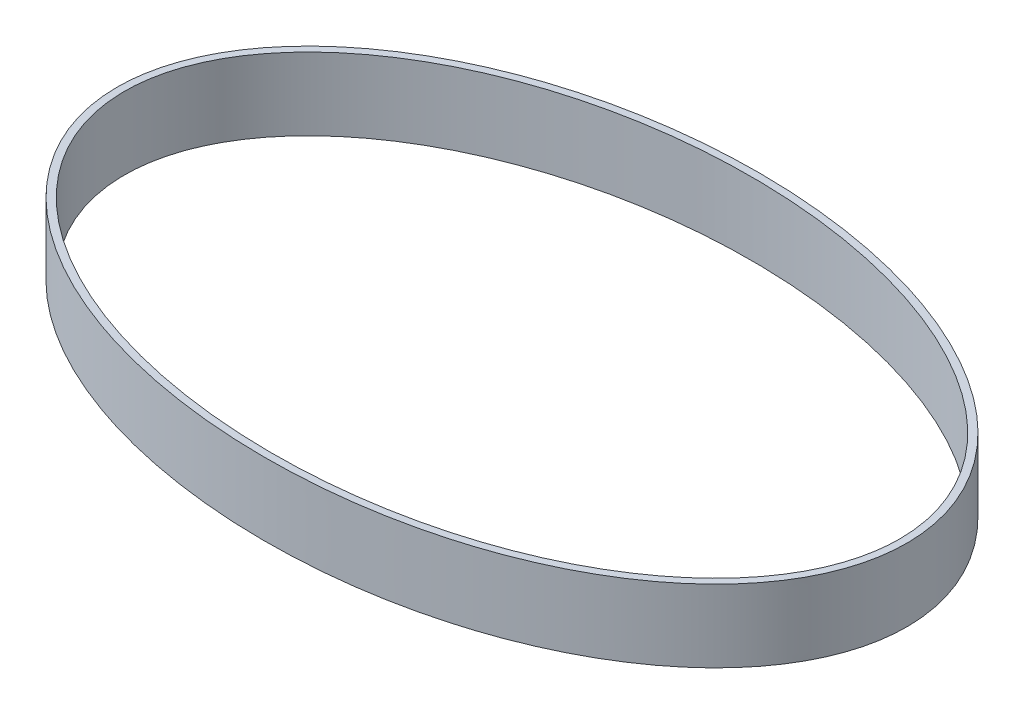
from build123d import *

# Parameters (mm, degrees)
EXTRUDE_THIN1_START = 30
EXTRUDE_THIN1_DEPTH = 10


with BuildPart() as part:
    # Extrude-Thin1: read off the stored shape, not the designer's step
    # Extrude-Thin1 outline → Extrude-Thin1 (new body)
    with BuildSketch(Plane(origin=(0, 0, 0), x_dir=(1, 0, 0), z_dir=(0, 1, 0)).offset(EXTRUDE_THIN1_START)):
        with BuildLine():
            add(Edge.make_bspline(
                [(-54.458550562, 0), (-54.458550562, -1.491590606), (-54.303571705, -2.955666602), (-53.856972588, -5.113764272), (-53.672267852, -5.826767498), (-53.232664192, -7.240311824), (-52.97661407, -7.942843143), (-52.122128576, -9.99313924), (-51.434860312, -11.296648312), (-50.251975795, -13.170041991), (-49.831325547, -13.78196293), (-48.945625421, -14.974668819), (-48.483790405, -15.551364009), (-47.047131283, -17.228482675), (-46.021443617, -18.276240055), (-43.855479785, -20.253105453), (-42.715064156, -21.182069066), (-40.928236374, -22.496609568), (-40.320016665, -22.92134939), (-39.091883949, -23.737813076), (-38.470421124, -24.130705007), (-36.585556864, -25.266915026), (-35.301760344, -25.967934705), (-31.378678435, -27.922307314), (-28.668360379, -29.028341969), (-25.17975991, -30.202032401), (-24.47579433, -30.426545605), (-23.064610629, -30.852981096), (-22.35751191, -31.054919338), (-20.231902266, -31.628445922), (-18.8090879, -31.967821328), (-14.52465232, -32.86623754), (-11.647145988, -33.306372018), (-5.852972875, -33.893509664), (-2.936284989, -34.040354857), (1.468173331, -34.040353822), (2.944640815, -34.003154018), (5.877605027, -33.854795181), (7.336834967, -33.743806516), (11.692766169, -33.300402018), (14.567870479, -32.858368247), (20.256756203, -31.663048913), (23.070638711, -30.910276474), (26.543511188, -29.743543956), (27.235840771, -29.49880313), (28.615755401, -28.985240007), (29.304551379, -28.715909561), (31.353309885, -27.873644167), (32.694305461, -27.267344814), (36.636201062, -25.302251242), (39.157878015, -23.800629341), (42.135101835, -21.6083325), (42.721449593, -21.153827273), (43.863156224, -20.219523097), (44.419981518, -19.738682059), (46.045687175, -18.252470862), (47.070116396, -17.203723989), (48.502308561, -15.528676716), (48.962227355, -14.953271505), (49.843392031, -13.764722936), (50.265456996, -13.149894667), (51.447938492, -11.273466549), (52.131803729, -9.972076797), (52.979789045, -7.934133325), (53.232703999, -7.24045524), (53.563470636, -6.17646824), (53.665682928, -5.817399906), (53.851097097, -5.099526797), (53.934628723, -4.739753744), (54.306435148, -2.936708318), (54.457760715, -1.480950699), (54.45894088, 0.723271974), (54.421581264, 1.461454692), (54.268666109, 2.944949013), (54.154501364, 3.676723108), (53.705887014, 5.842437822), (53.265718915, 7.247592664), (52.410525174, 9.301916742), (52.092612082, 9.977279812), (51.407740907, 11.285984837), (51.039432825, 11.922792636), (49.863701025, 13.785199852), (48.985827626, 14.963025772), (47.546472243, 16.646663968), (47.044352425, 17.195736077), (46.012196323, 18.256440729), (45.482145688, 18.768420577), (43.854054847, 20.254474414), (42.718270564, 21.178918914), (40.360794325, 22.914848361), (39.139013542, 23.726216512), (36.618865945, 25.248250242), (35.316643288, 25.960313753), (31.368430203, 27.927824525), (28.663282418, 29.029041802), (23.134879745, 30.891004221), (20.311276735, 31.650745821), (15.995550145, 32.558810516), (14.541991413, 32.822618756), (11.641864846, 33.269771873), (10.191193636, 33.454081152), (5.837441785, 33.894733756), (2.932633733, 34.039499935), (-2.881438513, 34.04120091), (-5.79070244, 33.898152915), (-10.158089566, 33.458074764), (-11.614469892, 33.273620387), (-14.528463466, 32.825074665), (-15.973984757, 32.562828211), (-20.274282712, 31.659554957), (-23.093580007, 30.903058502), (-28.625385779, 29.043634429), (-31.338244475, 27.941842951), (-36.630847023, 25.306425183), (-39.153799146, 23.801329757), (-42.698348148, 21.194717588), (-43.839898791, 20.266994542), (-45.480638942, 18.769994769), (-46.013425215, 18.255135084), (-47.04109792, 17.199123279), (-47.537153313, 16.656924631), (-48.968283772, 14.984802834), (-49.846798532, 13.809733302), (-51.029628261, 11.939418103), (-51.402813609, 11.294924521), (-52.090316036, 9.98213808), (-52.404380211, 9.315008283), (-53.253592146, 7.27999166), (-53.696397025, 5.878708227), (-54.150476326, 3.700788459), (-54.266058026, 2.962900478), (-54.419729309, 1.486560645), (-54.458550562, 0.745795303), (-54.458550562, 0)],
                knots=[0, 0, 0, 0, 0.015625, 0.015625, 0.0234375, 0.0234375, 0.03125, 0.03125, 0.046875, 0.046875, 0.0546875, 0.0546875, 0.0625, 0.0625, 0.078125, 0.078125, 0.09375, 0.09375, 0.1015625, 0.1015625, 0.109375, 0.109375, 0.125, 0.125, 0.15625, 0.15625, 0.1640625, 0.1640625, 0.171875, 0.171875, 0.1875, 0.1875, 0.21875, 0.21875, 0.25, 0.25, 0.265625, 0.265625, 0.28125, 0.28125, 0.3125, 0.3125, 0.34375, 0.34375, 0.3515625, 0.3515625, 0.359375, 0.359375, 0.375, 0.375, 0.40625, 0.40625, 0.4140625, 0.4140625, 0.421875, 0.421875, 0.4375, 0.4375, 0.4453125, 0.4453125, 0.453125, 0.453125, 0.46875, 0.46875, 0.4765625, 0.4765625, 0.48046875, 0.48046875, 0.484375, 0.484375, 0.5, 0.5, 0.5078125, 0.5078125, 0.515625, 0.515625, 0.53125, 0.53125, 0.5390625, 0.5390625, 0.546875, 0.546875, 0.5625, 0.5625, 0.5703125, 0.5703125, 0.578125, 0.578125, 0.59375, 0.59375, 0.609375, 0.609375, 0.625, 0.625, 0.65625, 0.65625, 0.6875, 0.6875, 0.703125, 0.703125, 0.71875, 0.71875, 0.75, 0.75, 0.78125, 0.78125, 0.796875, 0.796875, 0.8125, 0.8125, 0.84375, 0.84375, 0.875, 0.875, 0.90625, 0.90625, 0.921875, 0.921875, 0.9296875, 0.9296875, 0.9375, 0.9375, 0.953125, 0.953125, 0.9609375, 0.9609375, 0.96875, 0.96875, 0.984375, 0.984375, 0.9921875, 0.9921875, 1, 1, 1, 1], degree=3))
        make_face()
        with BuildLine():
            add(Edge.make_bspline(
                [(53.458550562, 0), (53.458550562, 57.227572117), (-26.729275281, 28.613786058), (-106.917101124, 0), (-26.729275281, -28.613786058), (53.458550562, -57.227572117), (53.458550562, 0)],
                knots=[0, 0, 0, 2.094395102, 2.094395102, 4.188790205, 4.188790205, 6.283185307, 6.283185307, 6.283185307], degree=2, weights=[1, 0.5, 1, 0.5, 1, 0.5, 1]))
        make_face(mode=Mode.SUBTRACT)
    extrude(amount=EXTRUDE_THIN1_DEPTH)


solid = part.part
